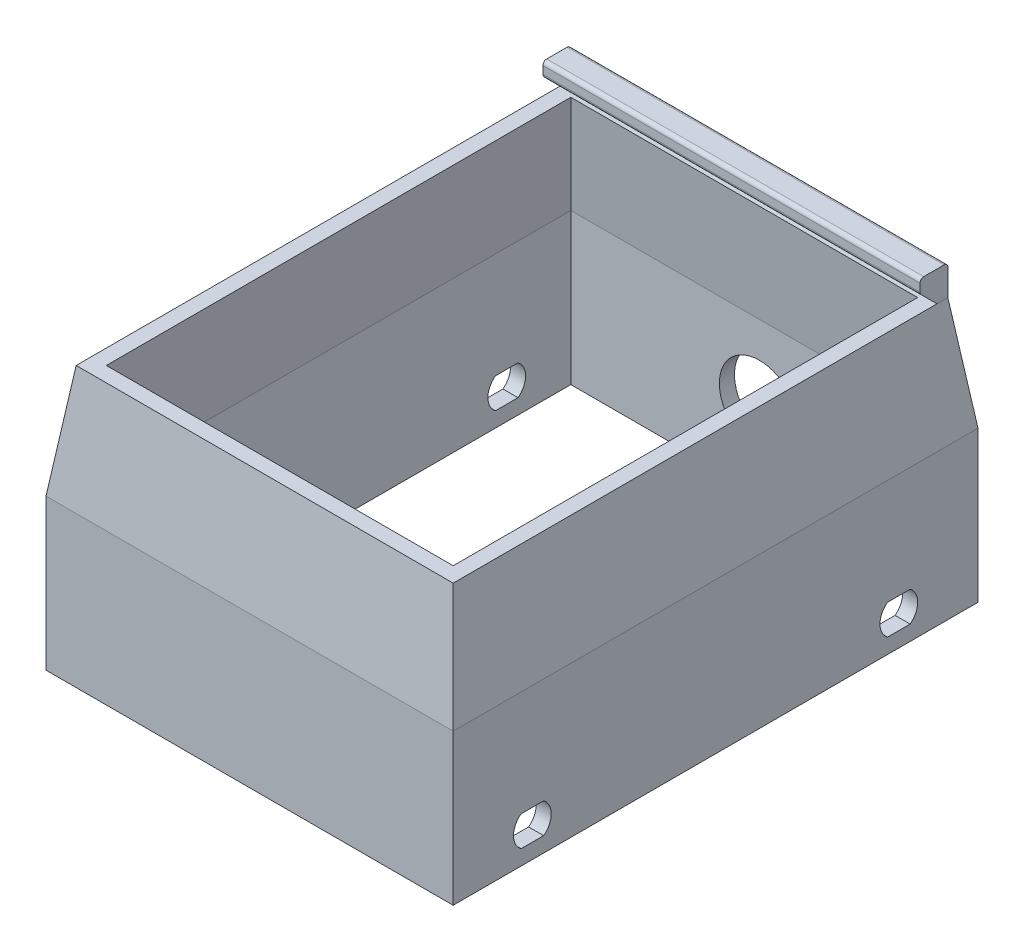
from build123d import *

# Parameters (mm, degrees)
BOSS_EXTRUDE1_DEPTH = 20
LOFT1_START         = -34.8
LOFT1_DEPTH         = 69.6
LOFT1_START_2       = -28
LOFT1_2_DEPTH       = 56
BOSS_EXTRUDE2_START = -2
BOSS_EXTRUDE2_DEPTH = 50
BOSS_EXTRUDE3_DEPTH = 2.3
BOSS_EXTRUDE4_DEPTH = 2.3
CUT_EXTRUDE1_START  = -69.6
SKETCH7_R           = 5.3
CUT_EXTRUDE1_DEPTH  = 2
CUT_EXTRUDE2_DEPTH  = 70


with BuildPart() as part:
    # Sketch1 → Boss-Extrude1 (new body)
    with BuildSketch(Plane(origin=(0, 0, 0), x_dir=(1, 0, 0), z_dir=(0, 1, 0))):
        Polygon((27, 34.8), (-27, 34.8), (-27, 0), (-27, -34.8), (27, -34.8), (27, 0), align=None)
        Polygon((25, 0), (25, 32.8), (-25, 32.8), (-25, 0), (-25, -32.8), (25, -32.8), align=None, mode=Mode.SUBTRACT)
    extrude(amount=BOSS_EXTRUDE1_DEPTH)

    # Loft1: read off the stored shape, not the designer's step
    # Loft1 outline → Loft1 (add)
    with BuildSketch(Plane.XY.offset(LOFT1_START)):
        Polygon((-27, 20), (27, 20), (25, 35), (-25, 35), align=None)
    extrude(amount=LOFT1_DEPTH)

    # Loft1 2 outline → Loft1 2 (cut)
    with BuildSketch(Plane.YZ.offset(LOFT1_START_2)):
        Polygon((20, 34.8), (35, 32.8), (35, 34.8), align=None)
        Polygon((35, -32.8), (20, -34.8), (35, -34.8), align=None)
    extrude(amount=LOFT1_2_DEPTH, mode=Mode.SUBTRACT)

    # Cut-Loft1: read off the stored shape, not the designer's step
    # Cut-Loft1: loft between two sections, ruled curve by curve
    cut_loft1_from = [
        Edge.make_line((-25, 20, 32.8), (-25, 20, -32.8)),
        Edge.make_line((-25, 20, -32.8), (25, 20, -32.8)),
        Edge.make_line((25, 20, 32.8), (-25, 20, 32.8)),
        Edge.make_line((25, 20, -32.8), (25, 20, 32.8)),
    ]
    cut_loft1_to = [
        Edge.make_line((-23, 35, 30.8), (-23, 35, -30.8)),
        Edge.make_line((-23, 35, -30.8), (23, 35, -30.8)),
        Edge.make_line((23, 35, 30.8), (-23, 35, 30.8)),
        Edge.make_line((23, 35, -30.8), (23, 35, 30.8)),
    ]
    cut_loft1 = Solid(Shell([*[Face.make_surface_from_curves(cut_loft1_from[k], cut_loft1_to[k]) for k in range(4)], Face(Wire(cut_loft1_from)), Face(Wire(cut_loft1_to))]))
    add(cut_loft1, mode=Mode.SUBTRACT)

    # Sketch2 → Boss-Extrude2 (add)
    with BuildSketch(Plane(origin=(27, 0, 0), x_dir=(0, 0, -1), z_dir=(1, 0, 0)).offset(BOSS_EXTRUDE2_START)):
        with BuildLine():
            Line((32.8, 35), (32.8, 38.5))
            ThreePointArc((32.8, 38.5), (32.653553391, 38.853553391), (32.3, 39))
            Line((32.3, 39), (29.6, 39))
            ThreePointArc((29.6, 39), (29.246446609, 38.853553391), (29.1, 38.5))
            Line((29.1, 38.5), (29.1, 37.468550682))
            ThreePointArc((29.1, 37.468550682), (29.138060234, 37.277208966), (29.246446609, 37.114997291))
            Line((29.246446609, 37.114997291), (31.361443901, 35))
            Line((31.361443901, 35), (32.8, 35))
        make_face()
    extrude(amount=-BOSS_EXTRUDE2_DEPTH)

    # Sketch7 → Cut-Extrude1 (cut)
    with BuildSketch(Plane.XY.offset(34.8).offset(CUT_EXTRUDE1_START)):
        with Locations((0, 10)):
            Circle(SKETCH7_R)
    extrude(amount=CUT_EXTRUDE1_DEPTH, mode=Mode.SUBTRACT)

    # Sketch8 → Cut-Extrude2 (cut)
    with BuildSketch(Plane.ZY.offset(27)):
        with BuildLine():
            Line((-25.8, 6), (-22.8, 6))
            ThreePointArc((-22.8, 6), (-21.8, 4), (-22.8, 2))
            Line((-22.8, 2), (-25.8, 2))
            ThreePointArc((-25.8, 2), (-26.8, 4), (-25.8, 6))
        make_face()
        with BuildLine():
            Line((22.8, 6), (25.8, 6))
            ThreePointArc((25.8, 6), (26.8, 4), (25.8, 2))
            Line((25.8, 2), (22.8, 2))
            ThreePointArc((22.8, 2), (21.8, 4), (22.8, 6))
        make_face()
    extrude(amount=-CUT_EXTRUDE2_DEPTH, mode=Mode.SUBTRACT)


with BuildPart() as body_2:
    # Sketch5 → Boss-Extrude3 (new body)
    with BuildSketch(Plane.XZ):
        with BuildLine():
            Line((-25, -34.8), (-25, -9.8))
            ThreePointArc((-25, -9.8), (0, 15.2), (25, -9.8))
            Line((25, -9.8), (25, -34.8))
            Line((25, -34.8), (27, -34.8))
            Line((27, -34.8), (27, 34.8))
            Line((27, 34.8), (-27, 34.8))
            Line((-27, 34.8), (-27, -34.8))
            Line((-27, -34.8), (-25, -34.8))
        make_face()
    extrude(amount=BOSS_EXTRUDE3_DEPTH)

    # Sketch6 → Boss-Extrude4 (add)
    with BuildSketch(Plane.XZ.offset(2.3)):
        with BuildLine():
            Line((22.7, -34.8), (27, -34.8))
            Line((27, -34.8), (27, 34.8))
            Line((27, 34.8), (-27, 34.8))
            Line((-27, 34.8), (-27, -34.8))
            Line((-27, -34.8), (-22.7, -34.8))
            Line((-22.7, -34.8), (-22.7, -9.8))
            ThreePointArc((-22.7, -9.8), (0, 12.9), (22.7, -9.8))
            Line((22.7, -9.8), (22.7, -34.8))
        make_face()
    extrude(amount=BOSS_EXTRUDE4_DEPTH)


solid = part.part
